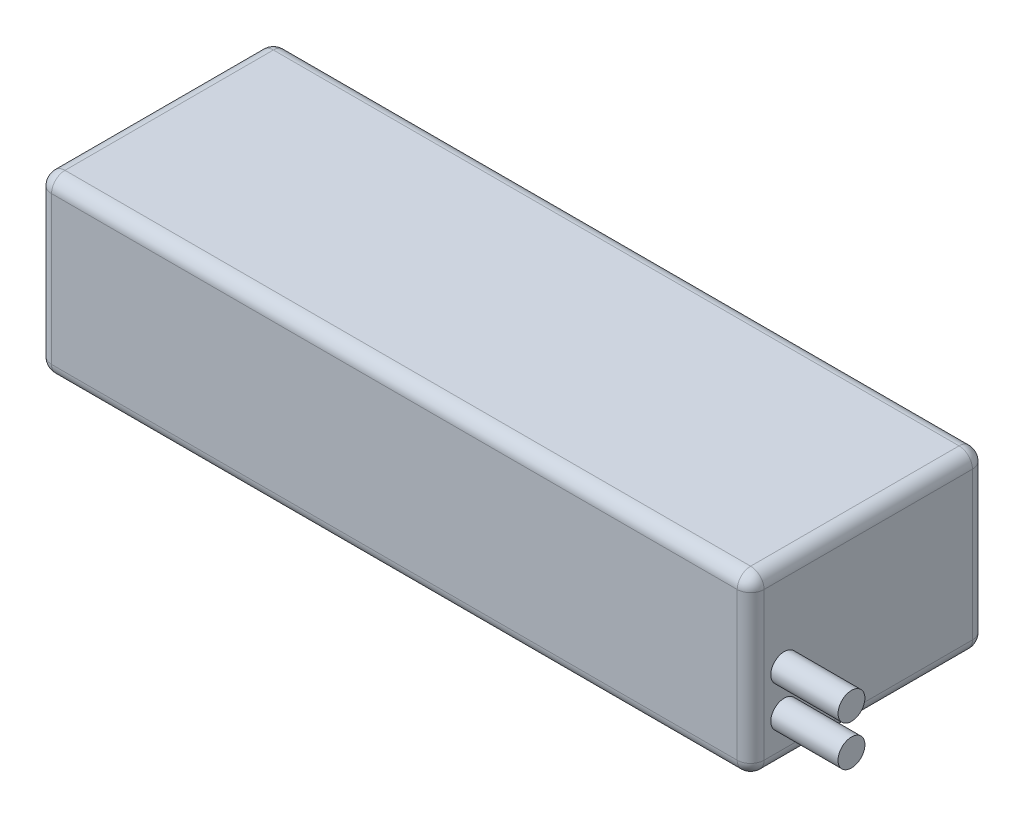
from build123d import *

# Parameters (mm, degrees)
SKETCH1_W           = 106
SKETCH1_H           = 35
BOSS_EXTRUDE1_DEPTH = 26
FILLET1_R           = 2
SKETCH2_R           = 2
BOSS_EXTRUDE2_DEPTH = 10


with BuildPart() as part:
    # Sketch1 → Boss-Extrude1 (new body)
    with BuildSketch(Plane(origin=(0, 0, 0), x_dir=(1, 0, 0), z_dir=(0, 1, 0))):
        Rectangle(SKETCH1_W, SKETCH1_H)
    extrude(amount=BOSS_EXTRUDE1_DEPTH)

    # Fillet1
    fillet1_edges = [part.edges().sort_by_distance(p)[0] for p in [
        (0, 0, 17.5),
        (0, 0, -17.5),
        (0, 26, -17.5),
        (0, 26, 17.5),
        (-53, 13, 17.5),
        (53, 13, 17.5),
        (-53, 0, 0),
        (-53, 26, 0),
        (-53, 13, -17.5),
        (53, 13, -17.5),
        (53, 0, 0),
        (53, 26, 0),
    ]]
    fillet(fillet1_edges, radius=FILLET1_R)

    # Sketch2 → Boss-Extrude2 (add)
    with BuildSketch(Plane(origin=(53, 0, 0), x_dir=(0, 0, -1), z_dir=(1, 0, 0))):
        with Locations((-12.5, 6.5)):
            Circle(SKETCH2_R)
        with Locations((-12.5, 12.5)):
            Circle(SKETCH2_R)
    extrude(amount=BOSS_EXTRUDE2_DEPTH)


solid = part.part
